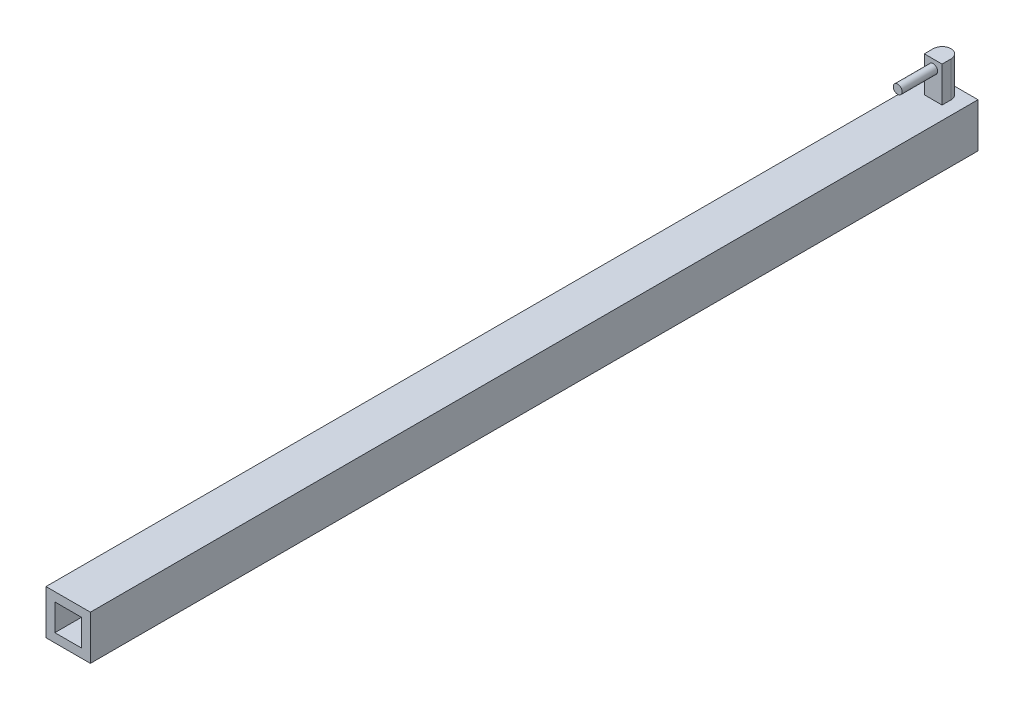
from build123d import *

# Parameters (mm, degrees)
SKETCH1_W           = 25
SKETCH1_H           = 25
SKETCH1_W_2         = 15
SKETCH1_H_2         = 15
BOSS_EXTRUDE1_DEPTH = 500
SKETCH2_W           = 10
SKETCH2_H           = 10
BOSS_EXTRUDE2_DEPTH = 20
SKETCH3_R           = 2.5
BOSS_EXTRUDE3_DEPTH = 20
FILLET2_R           = 5
FILLET3_R           = 5
SKETCH4_R           = 4.5
CUT_EXTRUDE1_DEPTH  = 5


with BuildPart() as part:
    # Sketch1 → Boss-Extrude1 (new body)
    with BuildSketch(Plane.XY):
        Rectangle(SKETCH1_W, SKETCH1_H)
        Rectangle(SKETCH1_W_2, SKETCH1_H_2, mode=Mode.SUBTRACT)
    extrude(amount=BOSS_EXTRUDE1_DEPTH)

    # Sketch2 → Boss-Extrude2 (add)
    with BuildSketch(Plane(origin=(0, 12.5, 0), x_dir=(1, 0, 0), z_dir=(0, 1, 0))):
        with Locations((0, -7.731161073)):
            Rectangle(SKETCH2_W, SKETCH2_H)
    extrude(amount=BOSS_EXTRUDE2_DEPTH)

    # Sketch3 → Boss-Extrude3 (add)
    with BuildSketch(Plane.XY.offset(12.731161073)):
        with Locations(Location((0, 27.707080849, 0), (0, 0, 180))):
            Circle(SKETCH3_R)
    extrude(amount=BOSS_EXTRUDE3_DEPTH)

    # Fillet2
    fillet2_edges = [part.edges().sort_by_distance(p)[0] for p in [
        (5, 22.5, 2.731161073),
    ]]
    fillet(fillet2_edges, radius=FILLET2_R)

    # Fillet3
    fillet3_edges = [part.edges().sort_by_distance(p)[0] for p in [
        (-5, 22.5, 2.731161073),
    ]]
    fillet(fillet3_edges, radius=FILLET3_R - 0.0001)  # a hair under: the kernel refuses the full size

    # Sketch4 → Cut-Extrude1 (cut)
    with BuildSketch(Plane.XZ.offset(12.5)):
        with Locations(Location((0, 70.986744053, 0), (0, 0, 270))):
            Circle(SKETCH4_R)
    extrude(amount=-CUT_EXTRUDE1_DEPTH, mode=Mode.SUBTRACT)


solid = part.part
